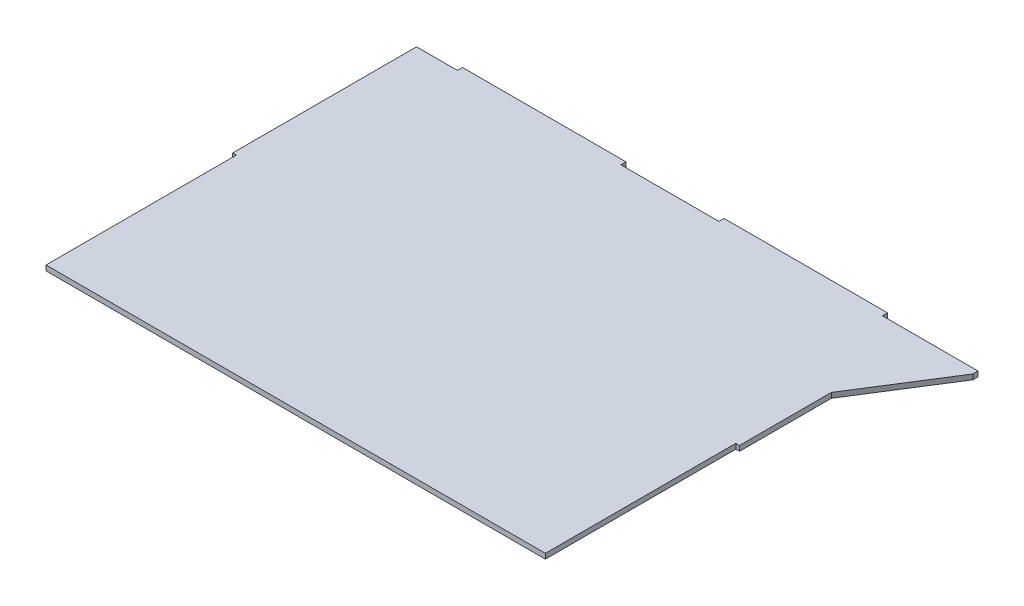
from build123d import *

# Parameters (mm, degrees)
SKETCH1_W           = 314.96461264
SKETCH1_H           = 3.175
BOSS_EXTRUDE1_DEPTH = 235.775
SKETCH3_W           = 25.4
SKETCH3_H           = 3.175
SKETCH3_W_2         = 60.96461264
CUT_EXTRUDE1_DEPTH  = 3.175
CUT_EXTRUDE2_START  = -3.175
SKETCH5_W           = 2.286
SKETCH5_H           = 118.364
CUT_EXTRUDE2_DEPTH  = 287.725009793
BOSS_EXTRUDE2_DEPTH = 3.175


with BuildPart() as part:
    # Sketch1 → Boss-Extrude1 (new body)
    with BuildSketch(Plane.XY):
        Rectangle(SKETCH1_W, SKETCH1_H)
    extrude(amount=BOSS_EXTRUDE1_DEPTH)

    # Sketch3 → Cut-Extrude1 (cut)
    with BuildSketch(Plane(origin=(0, 0, 0), x_dir=(-1, 0, 0), z_dir=(0, 0, -1))):
        with Locations((-144.78230632, 0)):
            Rectangle(SKETCH3_W, SKETCH3_H)
        Rectangle(SKETCH3_W_2, SKETCH3_H)
        with Locations((144.78230632, 0)):
            Rectangle(SKETCH3_W, SKETCH3_H)
    extrude(amount=-CUT_EXTRUDE1_DEPTH, mode=Mode.SUBTRACT)

    # Sketch5 → Cut-Extrude2 (cut)
    with BuildSketch(Plane(origin=(0, 1.5875, 0), x_dir=(1, 0, 0), z_dir=(0, 1, 0)).offset(CUT_EXTRUDE2_START)):
        with Locations((-156.33930632, -176.593)):
            Rectangle(SKETCH5_W, SKETCH5_H)
    cut_extrude2 = extrude(amount=CUT_EXTRUDE2_DEPTH, mode=Mode.SUBTRACT)

    # Mirror1: Cut-Extrude2 across plane
    add(cut_extrude2.mirror(Plane(origin=(0, 0, 0), x_dir=(0, 0, 1), z_dir=(1, 0, 0))), mode=Mode.SUBTRACT)

    # Sketch10 → Boss-Extrude2 (add)
    with BuildSketch(Plane(origin=(0, 1.5875, 0), x_dir=(1, 0, 0), z_dir=(0, 1, 0))):
        Polygon((157.48230632, -3.175), (191.51830632, -3.175), (191.51830632, -6.35), (157.48230632, -60.293), align=None)
    extrude(amount=-BOSS_EXTRUDE2_DEPTH)


solid = part.part
